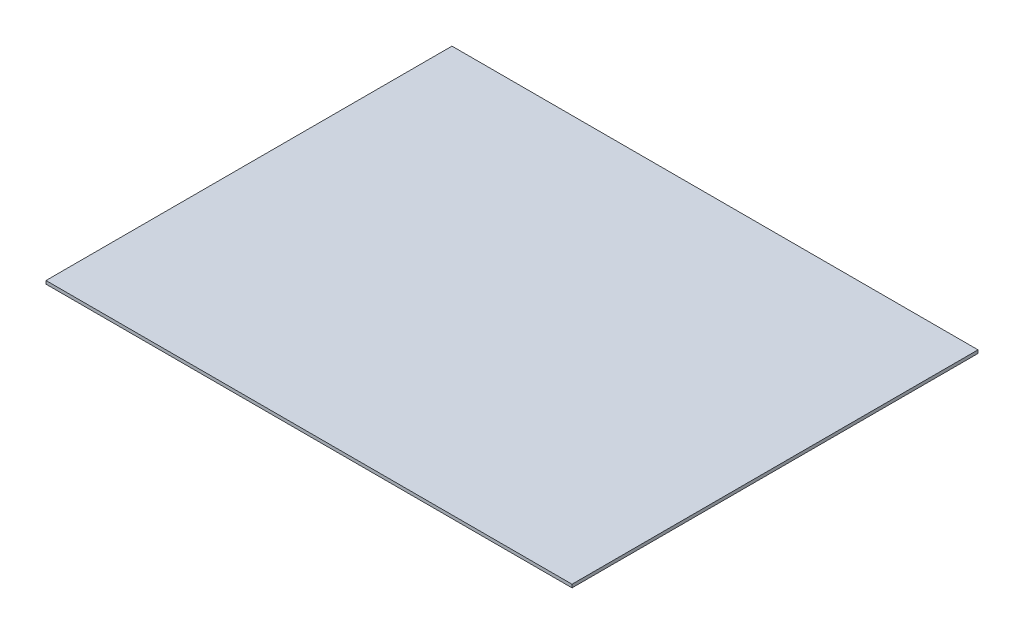
from build123d import *

# Parameters (mm, degrees)
SKETCH1_W           = 494
SKETCH1_H           = 3
BOSS_EXTRUDE1_DEPTH = 381.25


with BuildPart() as part:
    # Sketch1 → Boss-Extrude1 (new body)
    with BuildSketch(Plane.XY):
        with Locations((0, 104.5)):
            Rectangle(SKETCH1_W, SKETCH1_H)
    extrude(amount=BOSS_EXTRUDE1_DEPTH)


solid = part.part
